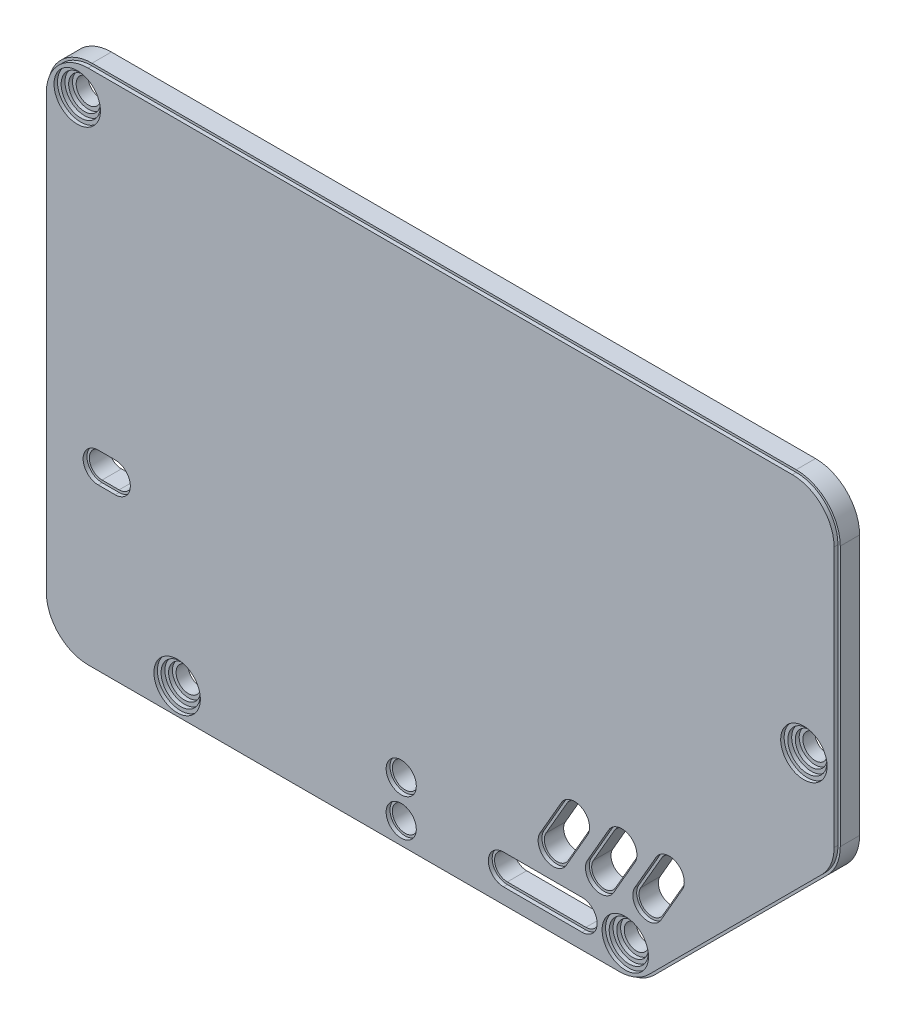
from build123d import *

# Parameters (mm, degrees)
BOSS_EXTRUDE1_DEPTH = 3
CUT_EXTRUDE1_DEPTH  = 121.966441627
SKETCH8_R           = 1
CUT_EXTRUDE2_DEPTH  = 10
SKETCH10_R          = 1
CUT_EXTRUDE4_DEPTH  = 10
SKETCH12_R          = 1.65
CUT_EXTRUDE5_DEPTH  = 10
SKETCH13_R          = 1.95
SKETCH13_R_2        = 1.65
CUT_EXTRUDE6_DEPTH  = 0.5


with BuildPart() as part:
    # Sketch2 → Boss-Extrude1 (new body)
    with BuildSketch(Plane.XY.offset(8.62)):
        with BuildLine():
            Line((4.5, 66.2), (95.5, 66.2))
            ThreePointArc((95.5, 66.2), (99.530508653, 64.530508653), (101.2, 60.5))
            Line((101.2, 60.5), (101.2, 26.863961031))
            ThreePointArc((101.2, 26.863961031), (100.766113335, 24.682665466), (99.530508653, 22.833452378))
            Line((99.530508653, 22.833452378), (77.166547622, 0.469491347))
            ThreePointArc((77.166547622, 0.469491347), (75.317334534, -0.766113335), (73.136038969, -1.2))
            Line((73.136038969, -1.2), (4.5, -1.2))
            ThreePointArc((4.5, -1.2), (0.469491347, 0.469491347), (-1.2, 4.5))
            Line((-1.2, 4.5), (-1.2, 60.5))
            ThreePointArc((-1.2, 60.5), (0.469491347, 64.530508653), (4.5, 66.2))
        make_face()
    extrude(amount=BOSS_EXTRUDE1_DEPTH)

    # Sketch6 → Cut-Extrude1 (cut, through all)
    with BuildSketch(Plane.XY.offset(11.62)):
        with BuildLine():
            Line((68.326, 1.398), (58.166, 1.398))
            ThreePointArc((58.166, 1.398), (56.516, 3.048), (58.166, 4.698))
            Line((58.166, 4.698), (68.326, 4.698))
            ThreePointArc((68.326, 4.698), (69.976, 3.048), (68.326, 1.398))
        make_face()
    extrude(amount=-CUT_EXTRUDE1_DEPTH, mode=Mode.SUBTRACT)

    # Sketch8 → Cut-Extrude2 (cut)
    with BuildSketch(Plane.XY.offset(11.62)):
        with Locations((44.958, 2.539999994)):
            Circle(SKETCH8_R)
        with Locations((44.958000001, 6.095999994)):
            Circle(SKETCH8_R)
    extrude(amount=-CUT_EXTRUDE2_DEPTH, mode=Mode.SUBTRACT)

    # Sketch10 → Cut-Extrude4 (cut)
    with BuildSketch(Plane.XY.offset(11.62)):
        with Locations((5.147878003, 21.843999999)):
            Circle(SKETCH10_R)
        with Locations((8.647878003, 21.843999999)):
            Circle(SKETCH10_R)
    extrude(amount=-CUT_EXTRUDE4_DEPTH, mode=Mode.SUBTRACT)

    # Sketch12 → Cut-Extrude5 (cut)
    with BuildSketch(Plane.XY.offset(11.62)):
        with Locations((44.958000001, 6.745999994)):
            Circle(SKETCH12_R)
        with Locations((44.958000001, 1.889999994)):
            Circle(SKETCH12_R)
        with BuildLine():
            Line((5.797878003, 23.493999999), (7.997878003, 23.493999999))
            ThreePointArc((7.997878003, 23.493999999), (9.647878003, 21.843999999), (7.997878003, 20.193999999))
            Line((7.997878003, 20.193999999), (5.797878003, 20.193999999))
            ThreePointArc((5.797878003, 20.193999999), (4.147878003, 21.843999999), (5.797878003, 23.493999999))
        make_face()
        with BuildLine():
            Line((69.29017176, 9.365911087), (72.03961641, 14.128088914))
            ThreePointArc((72.03961641, 14.128088914), (74.293558327, 14.73203083), (74.897500243, 12.478088914))
            Line((74.897500243, 12.478088914), (72.148055593, 7.715911087))
            ThreePointArc((72.148055593, 7.715911087), (69.894113677, 7.111969171), (69.29017176, 9.365911087))
        make_face()
        with BuildLine():
            Line((63.170258907, 9.365911087), (65.919703557, 14.128088914))
            ThreePointArc((65.919703557, 14.128088914), (68.173645473, 14.73203083), (68.777587389, 12.478088914))
            Line((68.777587389, 12.478088914), (66.028142739, 7.715911087))
            ThreePointArc((66.028142739, 7.715911087), (63.774200823, 7.111969171), (63.170258907, 9.365911087))
        make_face()
        with BuildLine():
            Line((75.410084614, 9.365911087), (78.159529264, 14.128088914))
            ThreePointArc((78.159529264, 14.128088914), (80.41347118, 14.73203083), (81.017413096, 12.478088914))
            Line((81.017413096, 12.478088914), (78.267968446, 7.715911087))
            ThreePointArc((78.267968446, 7.715911087), (76.01402653, 7.111969171), (75.410084614, 9.365911087))
        make_face()
    extrude(amount=-CUT_EXTRUDE5_DEPTH, mode=Mode.SUBTRACT)

    # Sketch13 → Cut-Extrude6 (cut)
    # profile 1 of 8: a face of its own
    with BuildSketch(Plane.XY.offset(11.62)):
        with BuildLine():
            Line((-1.2, 60.5), (-1.2, 4.5))
            ThreePointArc((-1.2, 4.5), (0.469491347, 0.469491347), (4.5, -1.2))
            Line((4.5, -1.2), (73.136038969, -1.2))
            ThreePointArc((73.136038969, -1.2), (75.317334534, -0.766113335), (77.166547622, 0.469491347))
            Line((77.166547622, 0.469491347), (99.530508653, 22.833452378))
            ThreePointArc((99.530508653, 22.833452378), (100.766113335, 24.682665466), (101.2, 26.863961031))
            Line((101.2, 26.863961031), (101.2, 60.5))
            ThreePointArc((101.2, 60.5), (99.530508653, 64.530508653), (95.5, 66.2))
            Line((95.5, 66.2), (4.5, 66.2))
            ThreePointArc((4.5, 66.2), (0.469491347, 64.530508653), (-1.2, 60.5))
        make_face()
        with BuildLine():
            Line((4.5, 65.9), (95.5, 65.9))
            ThreePointArc((95.5, 65.9), (99.318376618, 64.318376618), (100.9, 60.5))
            Line((100.9, 60.5), (100.9, 26.863961031))
            ThreePointArc((100.9, 26.863961031), (100.488949476, 24.797470496), (99.318376618, 23.045584412))
            Line((99.318376618, 23.045584412), (76.954415588, 0.681623382))
            ThreePointArc((76.954415588, 0.681623382), (75.202529504, -0.488949476), (73.136038969, -0.9))
            Line((73.136038969, -0.9), (4.5, -0.9))
            ThreePointArc((4.5, -0.9), (0.681623382, 0.681623382), (-0.9, 4.5))
            Line((-0.9, 4.5), (-0.9, 60.5))
            ThreePointArc((-0.9, 60.5), (0.681623382, 64.318376618), (4.5, 65.9))
        make_face(mode=Mode.SUBTRACT)
    # profile 2 of 8: a face of its own
    with BuildSketch(Plane.XY.offset(11.62)):
        with Locations((44.958000001, 1.889999994)):
            Circle(SKETCH13_R)
        with Locations((44.958000001, 1.889999994)):
            Circle(SKETCH13_R_2, mode=Mode.SUBTRACT)
    # profile 3 of 8: a face of its own
    with BuildSketch(Plane.XY.offset(11.62)):
        with Locations((44.958000001, 6.745999994)):
            Circle(SKETCH13_R)
        with Locations((44.958000001, 6.745999994)):
            Circle(SKETCH13_R_2, mode=Mode.SUBTRACT)
    # profile 4 of 8: a face of its own
    with BuildSketch(Plane.XY.offset(11.62)):
        with BuildLine():
            ThreePointArc((75.150276993, 9.515911087), (75.86402653, 6.85216155), (78.527776067, 7.565911087))
            Line((78.527776067, 7.565911087), (81.277220717, 12.328088914))
            ThreePointArc((81.277220717, 12.328088914), (80.56347118, 14.991838451), (77.899721643, 14.278088914))
            Line((77.899721643, 14.278088914), (75.150276993, 9.515911087))
        make_face()
        with BuildLine():
            ThreePointArc((78.159529264, 14.128088914), (80.41347118, 14.73203083), (81.017413096, 12.478088914))
            Line((81.017413096, 12.478088914), (78.267968446, 7.715911087))
            ThreePointArc((78.267968446, 7.715911087), (76.01402653, 7.111969171), (75.410084614, 9.365911087))
            Line((75.410084614, 9.365911087), (78.159529264, 14.128088914))
        make_face(mode=Mode.SUBTRACT)
    # profile 5 of 8: a face of its own
    with BuildSketch(Plane.XY.offset(11.62)):
        with BuildLine():
            ThreePointArc((69.030364139, 9.515911087), (69.744113677, 6.85216155), (72.407863214, 7.565911087))
            Line((72.407863214, 7.565911087), (75.157307864, 12.328088914))
            ThreePointArc((75.157307864, 12.328088914), (74.443558327, 14.991838451), (71.779808789, 14.278088914))
            Line((71.779808789, 14.278088914), (69.030364139, 9.515911087))
        make_face()
        with BuildLine():
            ThreePointArc((72.03961641, 14.128088914), (74.293558327, 14.73203083), (74.897500243, 12.478088914))
            Line((74.897500243, 12.478088914), (72.148055593, 7.715911087))
            ThreePointArc((72.148055593, 7.715911087), (69.894113677, 7.111969171), (69.29017176, 9.365911087))
            Line((69.29017176, 9.365911087), (72.03961641, 14.128088914))
        make_face(mode=Mode.SUBTRACT)
    # profile 6 of 8: a face of its own
    with BuildSketch(Plane.XY.offset(11.62)):
        with BuildLine():
            ThreePointArc((62.910451286, 9.515911087), (63.624200823, 6.85216155), (66.287950361, 7.565911087))
            Line((66.287950361, 7.565911087), (69.037395011, 12.328088914))
            ThreePointArc((69.037395011, 12.328088914), (68.323645473, 14.991838451), (65.659895936, 14.278088914))
            Line((65.659895936, 14.278088914), (62.910451286, 9.515911087))
        make_face()
        with BuildLine():
            ThreePointArc((65.919703557, 14.128088914), (68.173645473, 14.73203083), (68.777587389, 12.478088914))
            Line((68.777587389, 12.478088914), (66.028142739, 7.715911087))
            ThreePointArc((66.028142739, 7.715911087), (63.774200823, 7.111969171), (63.170258907, 9.365911087))
            Line((63.170258907, 9.365911087), (65.919703557, 14.128088914))
        make_face(mode=Mode.SUBTRACT)
    # profile 7 of 8: a face of its own
    with BuildSketch(Plane.XY.offset(11.62)):
        with BuildLine():
            ThreePointArc((58.166, 4.998), (56.216, 3.048), (58.166, 1.098))
            Line((58.166, 1.098), (68.326, 1.098))
            ThreePointArc((68.326, 1.098), (70.276, 3.048), (68.326, 4.998))
            Line((68.326, 4.998), (58.166, 4.998))
        make_face()
        with BuildLine():
            ThreePointArc((58.166, 1.398), (56.516, 3.048), (58.166, 4.698))
            Line((58.166, 4.698), (68.326, 4.698))
            ThreePointArc((68.326, 4.698), (69.976, 3.048), (68.326, 1.398))
            Line((68.326, 1.398), (58.166, 1.398))
        make_face(mode=Mode.SUBTRACT)
    # profile 8 of 8: a face of its own
    with BuildSketch(Plane.XY.offset(11.62)):
        with BuildLine():
            ThreePointArc((5.797878003, 23.793999999), (3.847878003, 21.843999999), (5.797878003, 19.893999999))
            Line((5.797878003, 19.893999999), (7.997878003, 19.893999999))
            ThreePointArc((7.997878003, 19.893999999), (9.947878003, 21.843999999), (7.997878003, 23.793999999))
            Line((7.997878003, 23.793999999), (5.797878003, 23.793999999))
        make_face()
        with BuildLine():
            ThreePointArc((7.997878003, 23.493999999), (9.647878003, 21.843999999), (7.997878003, 20.193999999))
            Line((7.997878003, 20.193999999), (5.797878003, 20.193999999))
            ThreePointArc((5.797878003, 20.193999999), (4.147878003, 21.843999999), (5.797878003, 23.493999999))
            Line((5.797878003, 23.493999999), (7.997878003, 23.493999999))
        make_face(mode=Mode.SUBTRACT)
    extrude(amount=-CUT_EXTRUDE6_DEPTH, mode=Mode.SUBTRACT)

    # Sketch14 → Cut-Revolve1 (revolve, cut)
    with BuildSketch(Plane(origin=(0, 2.5, 0), x_dir=(-1, 0, 0), z_dir=(0, -1, 0))):
        Polygon((-16, -11.62), (-16, -8.62), (-17.5875, -8.62), (-17.5875, -9.92), (-17.5875, -10.17), (-18.058333333, -10.17), (-18.058333333, -10.67), (-18.529166667, -10.67), (-18.529166667, -11.17), (-19, -11.17), (-19, -11.42), (-19, -11.62), align=None)
    cut_revolve1 = revolve(axis=Axis((16, 2.5, 11.62), (0, 0, -1)), mode=Mode.SUBTRACT)

    # Sketch-Pattern1: Cut-Revolve1 at 3 more places
    with Locations((-12.914214, 59.414214, 0), (57.917501, 0.15899, 0), (81, 33, 0)):
        add(cut_revolve1, mode=Mode.SUBTRACT)


solid = part.part
